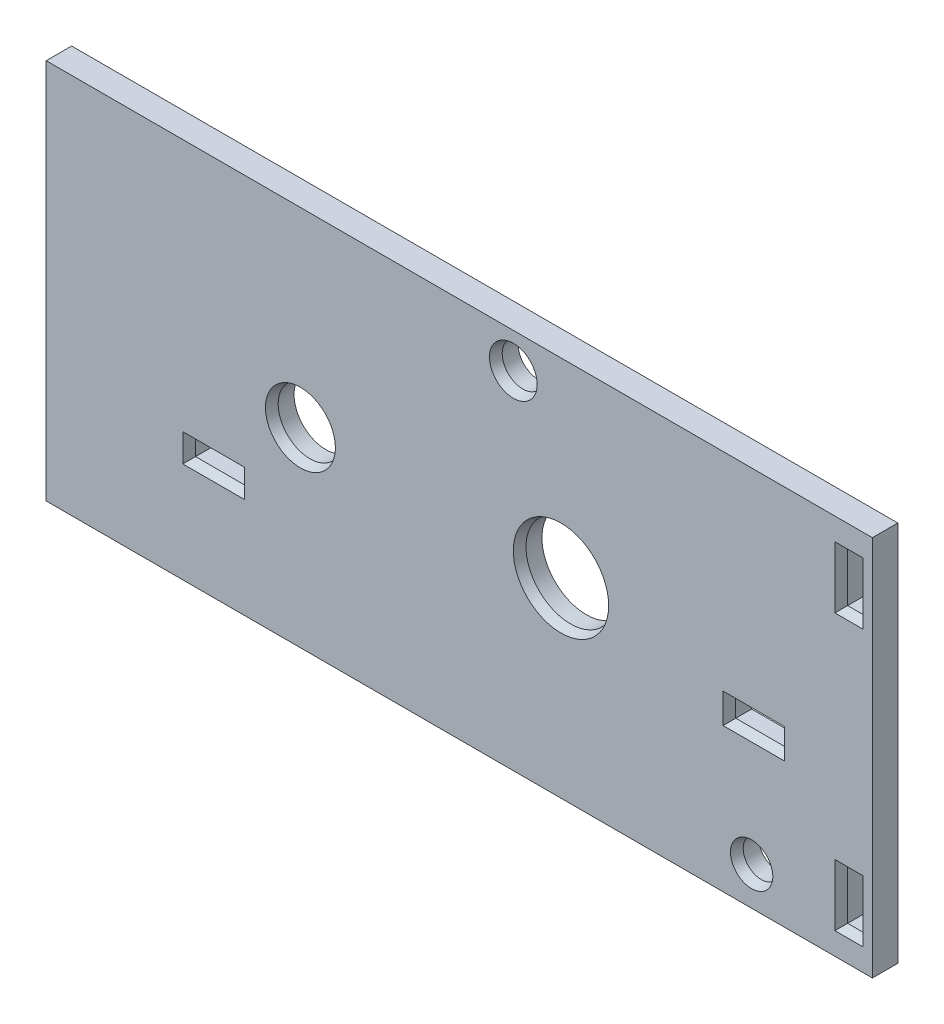
from build123d import *

# Parameters (mm, degrees)
SKETCH1_W           = 130
SKETCH1_H           = 60
SKETCH1_R           = 5
SKETCH1_R_2         = 3.25
SKETCH1_R_3         = 2.83
SKETCH1_R_4         = 7
SKETCH1_W_2         = 8.7
SKETCH1_H_2         = 3.4
SKETCH1_W_3         = 3.4
SKETCH1_H_3         = 8.7
SKETCH1_H_4         = 3.7
BOSS_EXTRUDE1_DEPTH = 2
CHAMFER1_SIZE       = 0.5
CHAMFER1_SIZE2      = 1.5


with BuildPart() as part:
    # Sketch1 → Boss-Extrude1 (new, symmetric)
    with BuildSketch(Plane.XY):
        with Locations((-21, 0)):
            Rectangle(SKETCH1_W, SKETCH1_H)
        with Locations((-46, 0)):
            Circle(SKETCH1_R, mode=Mode.SUBTRACT)
        with Locations((-12.5, 24.5)):
            Circle(SKETCH1_R_2, mode=Mode.SUBTRACT)
        with Locations((25, -24)):
            Circle(SKETCH1_R_3, mode=Mode.SUBTRACT)
        with Locations((-5, 0)):
            Circle(SKETCH1_R_4, mode=Mode.SUBTRACT)
        with Locations((-59.65, -12)):
            Rectangle(SKETCH1_W_2, SKETCH1_H_2, mode=Mode.SUBTRACT)
        with Locations((40.3, 21.65)):
            Rectangle(SKETCH1_W_3, SKETCH1_H_3, mode=Mode.SUBTRACT)
        with Locations((40.3, -21.65)):
            Rectangle(SKETCH1_W_3, SKETCH1_H_3, mode=Mode.SUBTRACT)
        with Locations((25.35, -5)):
            Rectangle(SKETCH1_W_2, SKETCH1_H_4, mode=Mode.SUBTRACT)
    extrude(amount=BOSS_EXTRUDE1_DEPTH, both=True)

    # Chamfer1
    chamfer1_edges = [part.edges().sort_by_distance(p)[0] for p in [
        (40.3, -26, 2),
        (42, -21.65, 2),
        (40.3, -17.3, 2),
        (38.6, -21.65, 2),
        (-12, 0, 2),
        (22.17, -24, 2),
        (-51, 0, 2),
        (-15.75, 24.5, 2),
        (-59.65, -13.7, 2),
        (-55.3, -12, 2),
        (-59.65, -10.3, 2),
        (-64, -12, 2),
        (25.35, -6.85, 2),
        (29.7, -5, 2),
        (25.35, -3.15, 2),
        (21, -5, 2),
        (40.3, 17.3, 2),
        (42, 21.65, 2),
        (40.3, 26, 2),
        (38.6, 21.65, 2),
    ]]
    chamfer1_side = [part.faces().sort_by_distance(p)[0] for p in [
        (-21.80048867, 0.041522908, 2),
    ]]
    chamfer(chamfer1_edges, length=CHAMFER1_SIZE, length2=CHAMFER1_SIZE2, reference=chamfer1_side[0])


solid = part.part
